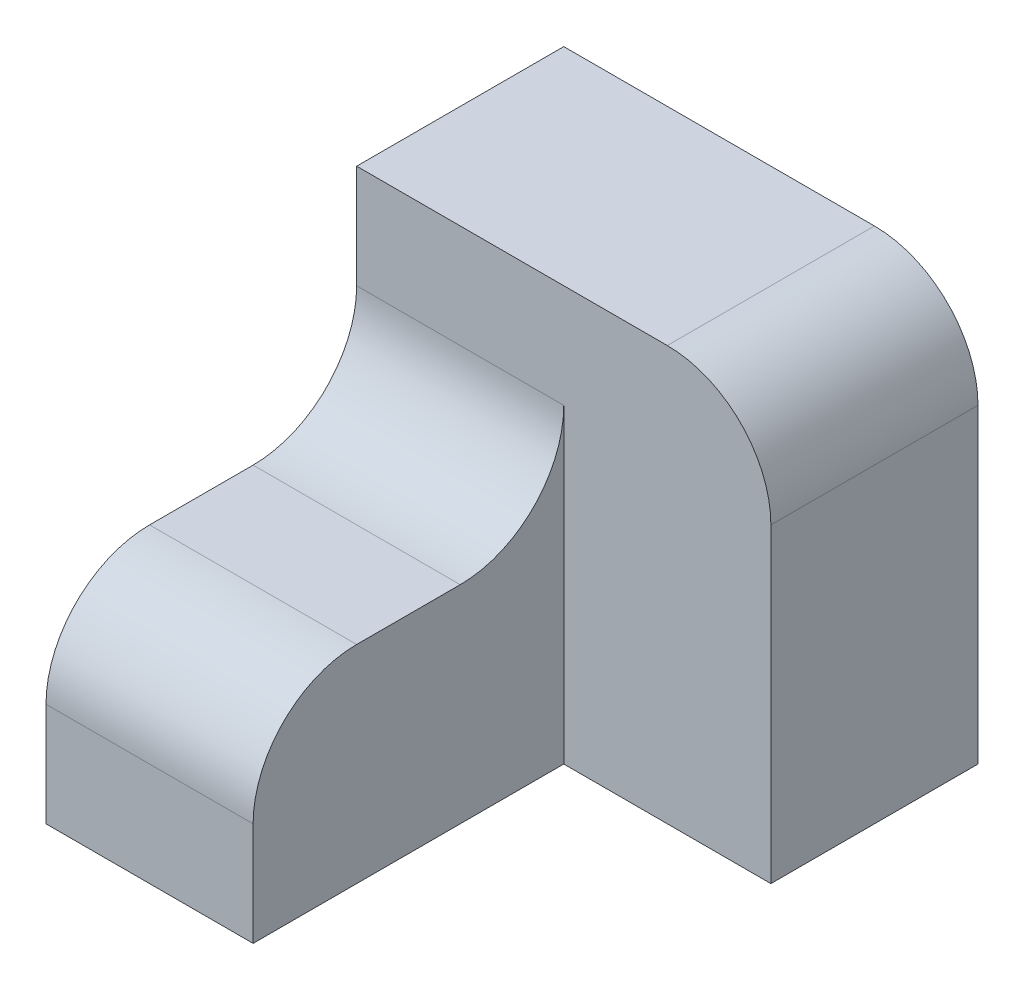
from build123d import *

# Parameters (mm, degrees)
BOSS_EXTRUDE1_DEPTH = 20
SKETCH2_W           = 20
SKETCH2_H           = 40
BOSS_EXTRUDE2_DEPTH = 20
FILLET1_R           = 10


with BuildPart() as part:
    # Sketch1 → Boss-Extrude1 (new body)
    with BuildSketch(Plane(origin=(0, 0, 0), x_dir=(0, 0, -1), z_dir=(1, 0, 0))):
        Polygon((0, 0), (50, 0), (50, 40), (30, 40), (30, 20), (0, 20), align=None)
    extrude(amount=BOSS_EXTRUDE1_DEPTH)

    # Sketch2 → Boss-Extrude2 (add)
    with BuildSketch(Plane(origin=(20, 0, 0), x_dir=(0, 0, -1), z_dir=(1, 0, 0))):
        with Locations((40, 20)):
            Rectangle(SKETCH2_W, SKETCH2_H)
    extrude(amount=BOSS_EXTRUDE2_DEPTH)

    # Fillet1
    fillet1_edges = [part.edges().sort_by_distance(p)[0] for p in [
        (10, 20, -30),
        (40, 40, -40),
        (10, 20, 0),
    ]]
    fillet(fillet1_edges, radius=FILLET1_R)


solid = part.part
